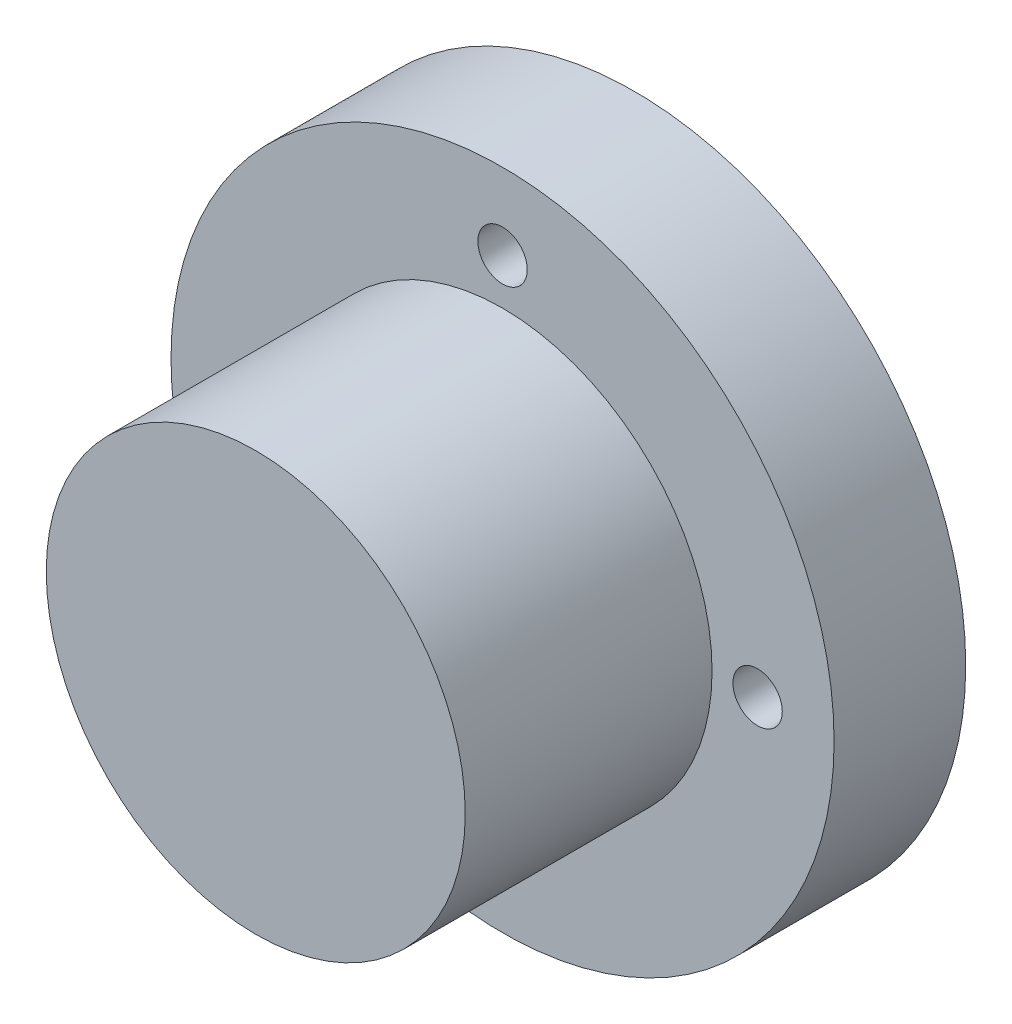
from build123d import *

# Parameters (mm, degrees)
SKETCH1_R           = 20.15
SKETCH1_R_2         = 1.5
BOSS_EXTRUDE1_DEPTH = 8
SKETCH2_R           = 12.732395447
BOSS_EXTRUDE2_DEPTH = 15


with BuildPart() as part:
    # Sketch1 → Boss-Extrude1 (new body)
    with BuildSketch(Plane.XY):
        Circle(SKETCH1_R)
        with Locations((15.5, 0)):
            Circle(SKETCH1_R_2, mode=Mode.SUBTRACT)
        with Locations((0, -15.5)):
            Circle(SKETCH1_R_2, mode=Mode.SUBTRACT)
        with Locations((-15.5, 0)):
            Circle(SKETCH1_R_2, mode=Mode.SUBTRACT)
        with Locations((0, 15.5)):
            Circle(SKETCH1_R_2, mode=Mode.SUBTRACT)
    extrude(amount=BOSS_EXTRUDE1_DEPTH)

    # Sketch2 → Boss-Extrude2 (add)
    with BuildSketch(Plane.XY.offset(8)):
        Circle(SKETCH2_R)
    extrude(amount=BOSS_EXTRUDE2_DEPTH)


solid = part.part
